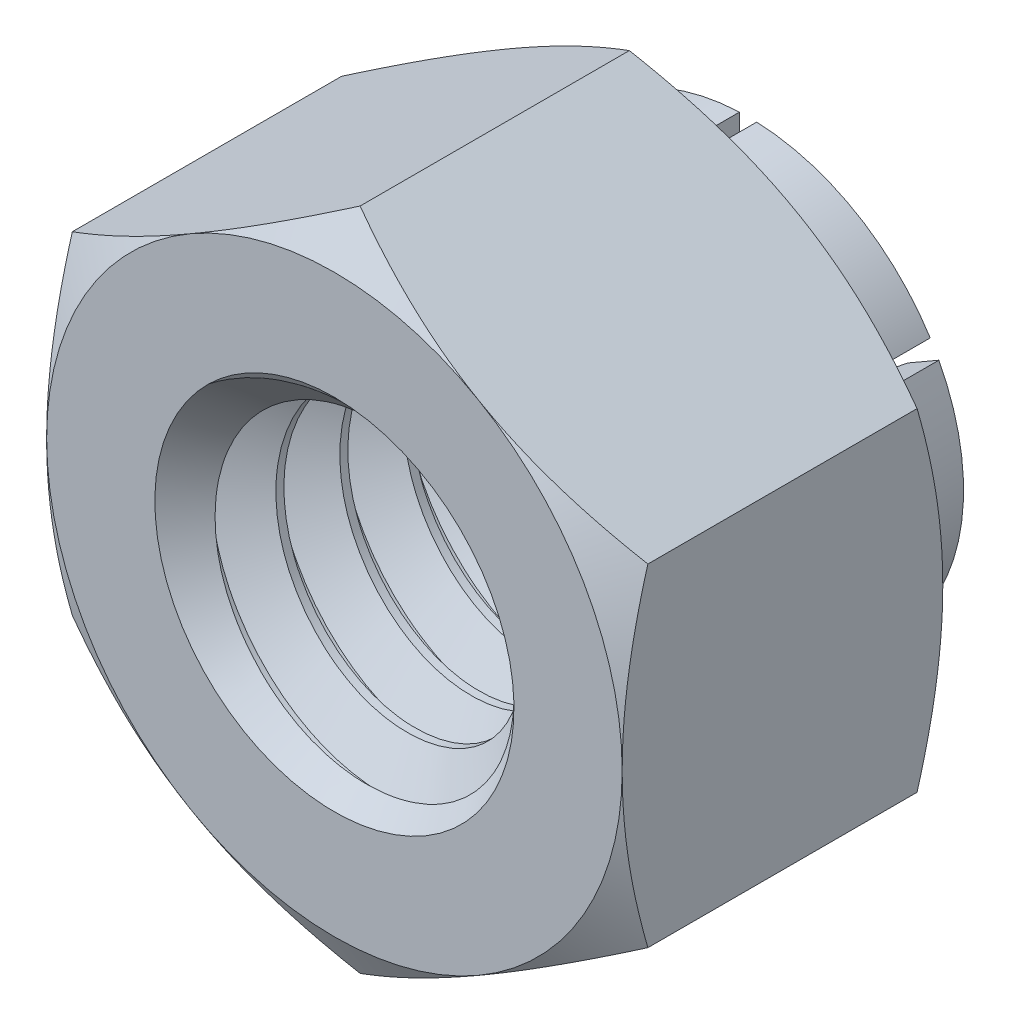
from build123d import *

# Parameters (mm, degrees)
EXTRUDE1_DEPTH          = 9.128125
SKETCH2_OUTSIDE_W       = 68.592
SKETCH2_OUTSIDE_H       = 70.556
SKETCH2_OUTSIDE_R       = 6.35
CUT_EXTRUDE1_DEPTH      = 14.319478194
CUT_EXTRUDE1_DRAFT      = -60
SKETCH4_R               = 3.9624
CUT_EXTRUDE3_DEPTH      = 14.319478194
SWEEP1_PITCH            = 1.411111111
CUT_EXTRUDE8_DEPTH      = 15.883842289
CUT_EXTRUDE9_DEPTH      = 14.319478365
SKETCH12_OUTSIDE_W      = 18.988
SKETCH12_OUTSIDE_H      = 20.952
SKETCH12_OUTSIDE_R      = 4.75488
CUT_EXTRUDE10_DEPTH     = 2.053828125
SKETCH15_W              = 0.381
SKETCH15_H              = 7.332348419
CUT_EXTRUDE_THIN2_DEPTH = 1.545828125
CIRPATTERN1_COUNT       = 6
SKETCH3_OUTSIDE_W       = 64.04
SKETCH3_OUTSIDE_H       = 66.004
SKETCH3_OUTSIDE_R       = 6.35
CUT_EXTRUDE2_DEPTH      = 13.005478429
CUT_EXTRUDE2_DRAFT      = -60


with BuildPart() as part:
    # Sketch1 → Extrude1 (new body)
    with BuildSketch(Plane.XY):
        Polygon((0, 7.332348419), (-6.35, 3.666174209), (-6.35, -3.666174209), (0, -7.332348419), (6.35, -3.666174209), (6.35, 3.666174209), align=None)
    extrude(amount=-EXTRUDE1_DEPTH)


with BuildPart() as cut_extrude1_tool:
    # Sketch2 outside → Cut-Extrude1 (with draft: the straight prism first)
    with BuildSketch(Plane.XY):
        Rectangle(SKETCH2_OUTSIDE_W, SKETCH2_OUTSIDE_H)
        Circle(SKETCH2_OUTSIDE_R, mode=Mode.SUBTRACT)
    extrude(amount=-CUT_EXTRUDE1_DEPTH)
    # Cut-Extrude1: the draft: its side faces are tilted about the plane it starts from
    cut_extrude1_sides = [cut_extrude1_tool.faces().sort_by_distance(p)[0] for p in [
        (0, -35.278, -7.159739097),
        (34.296, 0, -7.159739097),
        (0, 35.278, -7.159739097),
        (-34.296, 0, -7.159739097),
        (-6.35, 0, -7.159739097),
    ]]
    draft(cut_extrude1_sides, Plane.XY, CUT_EXTRUDE1_DRAFT)


with BuildPart() as part_1:
    add(part.part)

    # Cut-Extrude1: cut by cut_extrude1_tool
    add(cut_extrude1_tool.part, mode=Mode.SUBTRACT)

    # Sketch4 → Cut-Extrude3 (cut, through all)
    with BuildSketch(Plane.XY):
        Circle(SKETCH4_R)
    extrude(amount=-CUT_EXTRUDE3_DEPTH, mode=Mode.SUBTRACT)

    # Sweep1: arcs per turn and ends read off the stored shape
    # Sweep1: the profile of Sketch9 profile screwed along a right-hand helix through 8 turns, 6 arcs to a turn; built about Z, then put on its axis
    sweep1_z = Axis((0, 0, 0), (0, 0, 1))
    sweep1_corners = [(3.045856448, 0, -0.705555556), (3.045856448, 0, -0.529166667), (3.9627, 0, 0.000173205), (3.9627, 0, -1.234895427)]
    with BuildLine(mode=Mode.PRIVATE) as sweep1_profile:
        Line(sweep1_corners[0], sweep1_corners[1])
        Line(sweep1_corners[1], sweep1_corners[2])
        Line(sweep1_corners[2], sweep1_corners[3])
        Line(sweep1_corners[3], sweep1_corners[0])
    sweep1_cap = Face(sweep1_profile.wire())
    sweep1_turn_angles = [0, 30, 60, 90, 120, 150, 180, 210, 240, 270, 300, 330, 360]
    sweep1_turn_weights = [1, 0.8660254037844387, 1, 0.8660254037844387, 1, 0.8660254037844387, 1, 0.8660254037844387, 1, 0.8660254037844387, 1, 0.8660254037844387, 1]
    sweep1_turn_rails = [Edge.make_bspline([Vector(p[0], p[1], 0).rotate(sweep1_z, sweep1_turn_angles[k]) / sweep1_turn_weights[k] + Vector(0, 0, p[2] + SWEEP1_PITCH * sweep1_turn_angles[k] / 360) for k in range(13)], [0, 0, 0, 1, 1, 2, 2, 3, 3, 4, 4, 5, 5, 6, 6, 6], 2, sweep1_turn_weights) for p in sweep1_corners]
    sweep1_turn_sides = [Face.make_surface_from_curves(sweep1_turn_rails[p[0]], sweep1_turn_rails[p[1]]) for p in [(0, 1), (1, 2), (2, 3), (3, 0)]]
    sweep1 = Plane(origin=(0, 0, 0), x_dir=(0, 1, 0), z_dir=(0, 0, -1)) * Solid(Shell([*[p.moved(Location((0, 0, SWEEP1_PITCH * i))) for i in range(8) for p in sweep1_turn_sides], sweep1_cap, sweep1_cap.rotate(sweep1_z, 2880).moved(Location((0, 0, SWEEP1_PITCH * 2880 / 360)))]))
    add(sweep1)

    # Sketch10 → Cut-Extrude8 (cut, through all)
    with BuildSketch(Plane.XY):
        Polygon((0, 7.332348419), (-6.35, 3.666174209), (-6.35, -3.666174209), (0, -7.332348419), (6.35, -3.666174209), (6.35, 3.666174209), align=None)
    extrude(amount=CUT_EXTRUDE8_DEPTH, mode=Mode.SUBTRACT)

    # Sketch11 → Cut-Extrude9 (cut, through all)
    with BuildSketch(Plane(origin=(0, 0, -9.128125), x_dir=(-1, 0, 0), z_dir=(0, 0, -1))):
        Polygon((6.35, 3.666174209), (0, 7.332348419), (-6.35, 3.666174209), (-6.35, -3.666174209), (0, -7.332348419), (6.35, -3.666174209), align=None)
    extrude(amount=CUT_EXTRUDE9_DEPTH, mode=Mode.SUBTRACT)

    # Sketch12 outside → Cut-Extrude10 (cut)
    with BuildSketch(Plane(origin=(0, 0, -9.128125), x_dir=(-1, 0, 0), z_dir=(0, 0, -1))):
        Rectangle(SKETCH12_OUTSIDE_W, SKETCH12_OUTSIDE_H)
        Circle(SKETCH12_OUTSIDE_R, mode=Mode.SUBTRACT)
    extrude(amount=-CUT_EXTRUDE10_DEPTH, mode=Mode.SUBTRACT)

    # Sketch15 → Cut-Extrude-Thin2 (cut)
    with BuildSketch(Plane(origin=(0, 0, -9.128125), x_dir=(-1, 0, 0), z_dir=(0, 0, -1))):
        with Locations((0, -3.66617421)):
            Rectangle(SKETCH15_W, SKETCH15_H)
    cut_extrude_thin2 = extrude(amount=-CUT_EXTRUDE_THIN2_DEPTH, mode=Mode.SUBTRACT)

    # CirPattern1: Cut-Extrude-Thin2 ×6 about axis
    cirpattern1_axis = Axis((0, 0, 0), (0, 0, 1))
    for i in range(1, CIRPATTERN1_COUNT):
        add(cut_extrude_thin2.rotate(cirpattern1_axis, i * 360 / CIRPATTERN1_COUNT), mode=Mode.SUBTRACT)


with BuildPart() as cut_extrude2_tool:
    # Sketch3 outside → Cut-Extrude2 (with draft: the straight prism first)
    with BuildSketch(Plane(origin=(0, 0, -7.074296875), x_dir=(-1, 0, 0), z_dir=(0, 0, -1))):
        Rectangle(SKETCH3_OUTSIDE_W, SKETCH3_OUTSIDE_H)
        Circle(SKETCH3_OUTSIDE_R, mode=Mode.SUBTRACT)
    extrude(amount=-CUT_EXTRUDE2_DEPTH)
    # Cut-Extrude2: the draft: its side faces are tilted about the plane it starts from
    cut_extrude2_sides = [cut_extrude2_tool.faces().sort_by_distance(p)[0] for p in [
        (0, -33.002, -0.571557661),
        (-32.02, 0, -0.571557661),
        (0, 33.002, -0.571557661),
        (32.02, 0, -0.571557661),
        (6.35, 0, -0.571557661),
    ]]
    draft(cut_extrude2_sides, Plane(origin=(0, 0, -7.074296875), x_dir=(-1, 0, 0), z_dir=(0, 0, -1)), CUT_EXTRUDE2_DRAFT)


with BuildPart() as part_2:
    add(part_1.part)

    # Cut-Extrude2: cut by cut_extrude2_tool
    add(cut_extrude2_tool.part, mode=Mode.SUBTRACT)

    # Cut-Extrude6 cone 1 section (through the dimple's axis) → Cut-Extrude6 (revolve, cut)
    with BuildSketch(Plane(origin=(0, 0, 0), x_dir=(0, -1, 0), z_dir=(1, 0, 0))):
        Polygon((0, 0), (3.9624, 0), (0, 3.9624), align=None)
    revolve(axis=Axis((0, 0, 0), (0, 0, -1)), mode=Mode.SUBTRACT)

    # Cut-Extrude7 cone 1 section (through the dimple's axis) → Cut-Extrude7 (revolve, cut)
    with BuildSketch(Plane(origin=(0, 0, -9.128125), x_dir=(0, 1, 0), z_dir=(1, 0, 0))):
        Polygon((0, 0), (3.9624, 0), (0, 3.9624), align=None)
    revolve(axis=Axis((0, 0, -9.128125), (0, 0, 1)), mode=Mode.SUBTRACT)


solid = part_2.part
